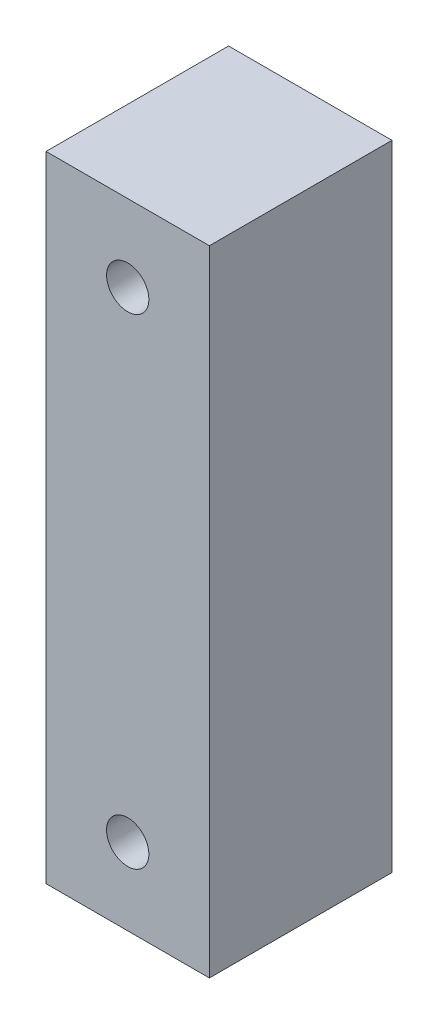
from build123d import *

# Parameters (mm, degrees)
SKETCH1_W           = 330
SKETCH1_H           = 95
BOSS_EXTRUDE1_DEPTH = 85
SKETCH3_R           = 11
CUT_EXTRUDE2_DEPTH  = 150


with BuildPart() as part:
    # Sketch1 → Boss-Extrude1 (new body)
    with BuildSketch(Plane.YZ):
        with Locations((0, -36)):
            Rectangle(SKETCH1_W, SKETCH1_H)
    extrude(amount=BOSS_EXTRUDE1_DEPTH)

    # Sketch3 → Cut-Extrude2 (cut)
    with BuildSketch(Plane.XY.offset(11.5)):
        with Locations((42.5, 125)):
            Circle(SKETCH3_R)
        with Locations((42.5, -125)):
            Circle(SKETCH3_R)
    extrude(amount=-CUT_EXTRUDE2_DEPTH, mode=Mode.SUBTRACT)


solid = part.part
